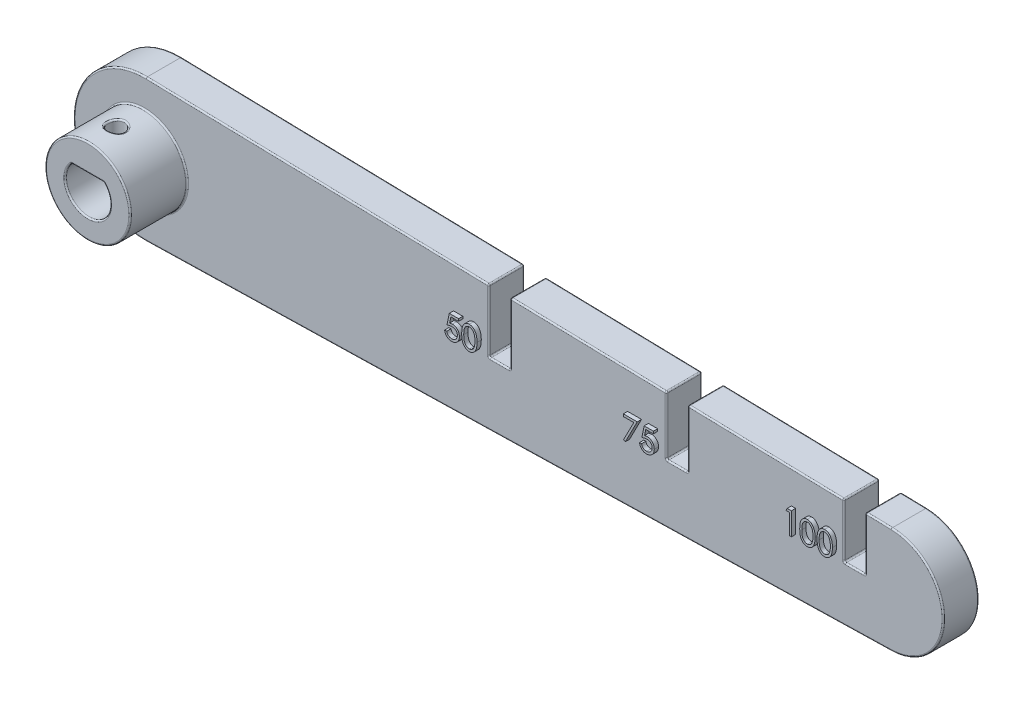
from build123d import *

# Parameters (mm, degrees)
BOSS_EXTRUDE1_DEPTH = 5
CUT_EXTRUDE2_REACH  = 115.054
CUT_EXTRUDE3_REACH  = 115.054
SKETCH4_W           = 3
SKETCH4_H           = 7.656932545
SKETCH4_H_2         = 8.25233943
SKETCH4_H_3         = 8.847746315
SKETCH6_R           = 6
BOSS_EXTRUDE3_DEPTH = 8
CUT_EXTRUDE4_REACH  = 115.689
SKETCH7_R           = 1.15
FILLET1_R           = 0.2
BOSS_EXTRUDE2_DEPTH = 0.6


with BuildPart() as part:
    # Sketch3 → Boss-Extrude1 (new body)
    with BuildSketch(Plane.XY):
        with BuildLine():
            Line((0.238095238, 9.997165131), (105.178571429, 7.497873848))
            ThreePointArc((105.178571429, 7.497873848), (112.5, 0), (105.178571429, -7.497873848))
            Line((105.178571429, -7.497873848), (0.238095238, -9.997165131))
            ThreePointArc((0.238095238, -9.997165131), (-10, 0), (0.238095238, 9.997165131))
        make_face()
    extrude(amount=BOSS_EXTRUDE1_DEPTH)

    # Sketch2 → Cut-Extrude2 (cut, up to next)
    with BuildSketch(Plane.XY, mode=Mode.PRIVATE) as cut_extrude2_sk1:
        with BuildLine():
            Line((-2.264950331, 2.225), (2.264950331, 2.225))
            ThreePointArc((2.264950331, 2.225), (0, -3.175), (-2.264950331, 2.225))
        make_face()
    cut_extrude2_tool1 = extrude(cut_extrude2_sk1.sketch, amount=CUT_EXTRUDE2_REACH, mode=Mode.PRIVATE) & part.part
    add(cut_extrude2_tool1.solids().sort_by_distance((0, -0.269884, 0))[0], mode=Mode.SUBTRACT)

    # Sketch4 → Cut-Extrude3 (cut, up to next)
    with BuildSketch(Plane.XY.offset(5), mode=Mode.PRIVATE) as cut_extrude3_sk1:
        with Locations((100, 3.828466273)):
            Rectangle(SKETCH4_W, SKETCH4_H)
    cut_extrude3_tool1 = extrude(cut_extrude3_sk1.sketch, amount=-CUT_EXTRUDE3_REACH, mode=Mode.PRIVATE) & part.part
    # Sketch4 → Cut-Extrude3 (cut, up to next)
    with BuildSketch(Plane.XY.offset(5), mode=Mode.PRIVATE) as cut_extrude3_sk2:
        with Locations((75, 4.126169715)):
            Rectangle(SKETCH4_W, SKETCH4_H_2)
    cut_extrude3_tool2 = extrude(cut_extrude3_sk2.sketch, amount=-CUT_EXTRUDE3_REACH, mode=Mode.PRIVATE) & part.part
    # Sketch4 → Cut-Extrude3 (cut, up to next)
    with BuildSketch(Plane.XY.offset(5), mode=Mode.PRIVATE) as cut_extrude3_sk3:
        with Locations((50, 4.423873158)):
            Rectangle(SKETCH4_W, SKETCH4_H_3)
    cut_extrude3_tool3 = extrude(cut_extrude3_sk3.sketch, amount=-CUT_EXTRUDE3_REACH, mode=Mode.PRIVATE) & part.part
    add(cut_extrude3_tool1.solids().sort_by_distance((100, 3.828466, 5))[0], mode=Mode.SUBTRACT)
    add(cut_extrude3_tool2.solids().sort_by_distance((75, 4.12617, 5))[0], mode=Mode.SUBTRACT)
    add(cut_extrude3_tool3.solids().sort_by_distance((50, 4.423873, 5))[0], mode=Mode.SUBTRACT)

    # Sketch6 → Boss-Extrude3 (add)
    with BuildSketch(Plane.XY.offset(5)):
        Circle(SKETCH6_R)
        with BuildLine():
            Line((-2.264950331, 2.225), (2.264950331, 2.225))
            ThreePointArc((2.264950331, 2.225), (0, -3.175), (-2.264950331, 2.225))
        make_face(mode=Mode.SUBTRACT)
    extrude(amount=BOSS_EXTRUDE3_DEPTH)

    # Sketch7 → Cut-Extrude4 (cut, up to next)
    with BuildSketch(Plane(origin=(0, 0, 0), x_dir=(1, 0, 0), z_dir=(0, 1, 0)), mode=Mode.PRIVATE) as cut_extrude4_sk1:
        with Locations((0, -9)):
            Circle(SKETCH7_R)
    cut_extrude4_tool1 = extrude(cut_extrude4_sk1.sketch, amount=CUT_EXTRUDE4_REACH, mode=Mode.PRIVATE) & part.part
    add(cut_extrude4_tool1.solids().sort_by_distance((0, 0, 9))[0], mode=Mode.SUBTRACT)

    # Fillet1
    fillet1_edges = [part.edges().sort_by_distance(p)[0] for p in [
        (51.5, 0, 2.5),
        (48.5, 0, 2.5),
        (101.5, 0, 2.5),
        (98.5, 0, 2.5),
        (76.5, 0, 2.5),
        (73.5, 0, 2.5),
        (0, 2.225, 0),
        (0, -3.175, 0),
        (76.5, 4.090445302, 0),
        (75, 0, 0),
        (73.5, 4.126169715, 0),
        (62.5, 8.51431846, 0),
        (51.5, 4.388148745, 0),
        (50, 0, 0),
        (48.5, 4.423873158, 0),
        (24.369047619, 9.422455723, 0),
        (-10, 0, 0),
        (52.708333333, -8.74751949, 0),
        (112.5, 0, 0),
        (103.339285714, 7.541678783, 0),
        (101.5, 3.792741859, 0),
        (100, 0, 0),
        (98.5, 3.828466272, 0),
        (87.5, 7.918911574, 0),
        (100, 0, 5),
        (101.5, 3.792741859, 5),
        (103.339285714, 7.541678783, 5),
        (112.5, 0, 5),
        (52.708333333, -8.74751949, 5),
        (-10, 0, 5),
        (24.369047619, 9.422455723, 5),
        (48.5, 4.423873158, 5),
        (50, 0, 5),
        (51.5, 4.388148745, 5),
        (62.5, 8.51431846, 5),
        (73.5, 4.126169715, 5),
        (75, 0, 5),
        (76.5, 4.090445302, 5),
        (87.5, 7.918911574, 5),
        (98.5, 3.828466272, 5),
        (101.5, 7.585483719, 2.5),
        (98.5, 7.656932545, 2.5),
        (76.5, 8.180890604, 2.5),
        (73.5, 8.25233943, 2.5),
        (51.5, 8.776297489, 2.5),
        (48.5, 8.847746315, 2.5),
        (-6, 0, 5),
        (0, 2.225, 13),
        (2.264950331, 2.225, 6.5),
        (0, -3.175, 13),
        (-2.264950331, 2.225, 6.5),
        (-1.150000012, 5.888760487, 9.000000001),
        (-1.15, 2.225, 9),
        (-6, 0, 13),
    ]]
    fillet(fillet1_edges, radius=FILLET1_R)

    # Sketch5 → Boss-Extrude2 (add)
    # profile 1 of 7: a face of its own
    with BuildSketch(Plane.XY.offset(5)):
        with BuildLine():
            Line((44.816666667, 3.175), (44.816666667, 2.849358974))
            Line((44.816666667, 2.849358974), (43.736708734, 2.849358974))
            Line((43.736708734, 2.849358974), (43.565619992, 2.014267829))
            add(Edge.make_bspline(
                [(43.565619992, 2.014267829), (43.599234964, 2.023548147), (43.664358655, 2.041527295), (43.760479386, 2.061489672), (43.851730885, 2.073523325), (43.910944971, 2.075166443), (43.939598357, 2.075961538)],
                knots=[0, 0, 0, 0, 1.100273476, 2.13160584, 3.095893838, 4, 4, 4, 4], degree=3))
            add(Edge.make_bspline(
                [(43.939598357, 2.075961538), (43.975052893, 2.075194154), (44.044765367, 2.073685284), (44.146763555, 2.059196535), (44.244129822, 2.036391041), (44.336660544, 2.004531711), (44.424526901, 1.963792167), (44.506920474, 1.912901507), (44.58507801, 1.853453414), (44.657597363, 1.785104724), (44.723387271, 1.709882972), (44.781232133, 1.629004046), (44.83036534, 1.543253952), (44.869881167, 1.4518134), (44.901435528, 1.355693311), (44.922437695, 1.253882325), (44.936422852, 1.147340102), (44.937985302, 1.074492385), (44.938782051, 1.037344752)],
                knots=[0, 0, 0, 0, 1.052922333, 2.070308379, 3.05430497, 4.020497103, 4.973039431, 5.925935799, 6.892292201, 7.88610001, 8.88166317, 9.857072816, 10.836096531, 11.812156883, 12.81219415, 13.836441305, 14.89672472, 16, 16, 16, 16], degree=3))
            add(Edge.make_bspline(
                [(44.938782051, 1.037344752), (44.938178733, 1.011471023), (44.93698025, 0.960073227), (44.930885531, 0.883742417), (44.919150989, 0.809027561), (44.903395982, 0.735918748), (44.882946788, 0.664554389), (44.858191718, 0.594730218), (44.82789675, 0.526880824), (44.79466686, 0.460364216), (44.757250412, 0.396684142), (44.715722766, 0.337131132), (44.671848356, 0.28081182), (44.624639385, 0.228330219), (44.573657054, 0.180031196), (44.519518798, 0.135628112), (44.462656617, 0.094370048), (44.40219079, 0.057931757), (44.339468681, 0.024401075), (44.273584512, -0.003106705), (44.20603802, -0.027699827), (44.135857025, -0.047302756), (44.063200495, -0.062663002), (43.987948663, -0.073095689), (43.910496198, -0.080694315), (43.857995294, -0.081169982), (43.831475361, -0.081410256)],
                knots=[0, 0, 0, 0, 1.056347294, 2.098418968, 3.122841568, 4.141288669, 5.149314143, 6.15115421, 7.162517403, 8.180376062, 9.185164535, 10.17417709, 11.141909838, 12.097768115, 13.052685741, 14.0056014, 14.954263652, 15.917497458, 16.885230207, 17.854509472, 18.828990115, 19.81800267, 20.826176721, 21.857883937, 22.917946725, 24, 24, 24, 24], degree=3))
            add(Edge.make_bspline(
                [(43.831475361, -0.081410256), (43.799839497, -0.080783568), (43.737599672, -0.079550632), (43.646413157, -0.066652434), (43.558679194, -0.048179453), (43.47510403, -0.02038798), (43.39493867, 0.014434781), (43.319262347, 0.058445879), (43.246141393, 0.10831978), (43.178548331, 0.167175529), (43.115813857, 0.231506183), (43.05965581, 0.301317758), (43.009641779, 0.375458038), (42.96657268, 0.454287077), (42.929835189, 0.537597745), (42.90097445, 0.625702181), (42.877680514, 0.718140042), (42.867825839, 0.781779298), (42.862820513, 0.814102564)],
                knots=[0, 0, 0, 0, 1.0467383, 2.05933395, 3.04377827, 4.011590433, 4.970194871, 5.932262533, 6.905835911, 7.896367577, 8.894135286, 9.877477877, 10.858688626, 11.851381753, 12.8477658, 13.868841284, 14.917554742, 16, 16, 16, 16], degree=3))
            Line((42.862820513, 0.814102564), (43.14775641, 0.814102564))
            add(Edge.make_bspline(
                [(43.14775641, 0.814102564), (43.154767316, 0.783825354), (43.168242666, 0.725630874), (43.197820738, 0.643868872), (43.233984782, 0.571007861), (43.276987298, 0.506084025), (43.328286254, 0.449470149), (43.386823665, 0.399017529), (43.452453385, 0.353501518), (43.525381529, 0.315562294), (43.602319108, 0.283205639), (43.682843649, 0.261659459), (43.764762592, 0.246509363), (43.820169399, 0.244992837), (43.848011819, 0.244230769)],
                knots=[0, 0, 0, 0, 1.136247022, 2.183929868, 3.172523383, 4.106158343, 5.02341133, 5.958108904, 6.928429099, 7.938127109, 8.96079061, 9.975095812, 10.982467395, 12, 12, 12, 12], degree=3))
            add(Edge.make_bspline(
                [(43.848011819, 0.244230769), (43.875188408, 0.244975332), (43.928699334, 0.246441382), (44.007449663, 0.257725343), (44.083479913, 0.275103997), (44.156039872, 0.301111651), (44.226399269, 0.332720789), (44.292778332, 0.37328375), (44.357097371, 0.419965339), (44.417357178, 0.473447424), (44.472547249, 0.532384219), (44.521311731, 0.59541014), (44.561930788, 0.662644708), (44.596161015, 0.732923925), (44.622153651, 0.807018045), (44.640696541, 0.884579825), (44.65158503, 0.965800843), (44.653082886, 1.021199431), (44.653846154, 1.049429087)],
                knots=[0, 0, 0, 0, 1.027316725, 2.022795036, 3.002884548, 3.971462791, 4.93288096, 5.914575861, 6.907176829, 7.935150275, 8.956128384, 9.956726525, 10.942570165, 11.921478529, 12.907843606, 13.90538589, 14.932640048, 16, 16, 16, 16], degree=3))
            add(Edge.make_bspline(
                [(44.653846154, 1.049429087), (44.653248819, 1.074897804), (44.652079621, 1.124749195), (44.642526889, 1.197682761), (44.625910778, 1.266691878), (44.602847687, 1.33210979), (44.573565563, 1.393998198), (44.537782122, 1.452420974), (44.494825825, 1.506608094), (44.445756755, 1.556584911), (44.392001246, 1.602708476), (44.332634423, 1.642027754), (44.268898632, 1.675105737), (44.201561781, 1.703651707), (44.129022195, 1.724153812), (44.052716392, 1.739546108), (43.971820379, 1.748450044), (43.916511254, 1.749685471), (43.888080929, 1.750320513)],
                knots=[0, 0, 0, 0, 1.045622112, 2.046656509, 3.013763289, 3.955457236, 4.890082067, 5.820317437, 6.762574623, 7.722996705, 8.69280354, 9.665887285, 10.63943826, 11.638615906, 12.663482002, 13.728887084, 14.832589034, 16, 16, 16, 16], degree=3))
            add(Edge.make_bspline(
                [(43.888080929, 1.750320513), (43.863471115, 1.749793834), (43.812658093, 1.748706375), (43.734713815, 1.740699481), (43.652806323, 1.727782407), (43.567249602, 1.710014883), (43.477786713, 1.686763834), (43.384606449, 1.658901395), (43.287512893, 1.625589296), (43.222091814, 1.600432216), (43.188461538, 1.5875)],
                knots=[0, 0, 0, 0, 0.817624296, 1.688186739, 2.600797293, 3.572016777, 4.590301741, 5.671205678, 6.80286297, 8, 8, 8, 8], degree=3))
            Line((43.188461538, 1.5875), (43.514102564, 3.175))
            Line((43.514102564, 3.175), (44.816666667, 3.175))
        make_face()
    # profile 2 of 7: a face of its own
    with BuildSketch(Plane.XY.offset(5)):
        with BuildLine():
            add(Edge.make_bspline(
                [(45.264423077, 1.586227965), (45.264720636, 1.637116309), (45.26529865, 1.735967652), (45.27172886, 1.880008006), (45.282410778, 2.015136268), (45.29704968, 2.141358907), (45.314864134, 2.258708507), (45.338645325, 2.366871466), (45.365689796, 2.466348394), (45.3970338, 2.557463681), (45.432401295, 2.641444883), (45.470895231, 2.719844887), (45.514043295, 2.792545069), (45.559379494, 2.860705779), (45.608739016, 2.923211273), (45.660717205, 2.98094426), (45.717342764, 3.032570441), (45.776690779, 3.079602444), (45.839298571, 3.120831607), (45.903381561, 3.15714702), (45.969380836, 3.188171185), (46.037476588, 3.212564652), (46.107056765, 3.232713063), (46.178364604, 3.246491609), (46.251517842, 3.25516109), (46.300894929, 3.255989917), (46.325936498, 3.256410256)],
                knots=[0, 0, 0, 0, 1.646270934, 3.197905019, 4.663502075, 6.030701355, 7.308322542, 8.50163776, 9.611534131, 10.641858119, 11.616356847, 12.558055219, 13.465016945, 14.349605745, 15.204443733, 16.039544428, 16.859896111, 17.680448484, 18.487036065, 19.28249412, 20.06191084, 20.843045899, 21.620316918, 22.403196591, 23.190181807, 24, 24, 24, 24], degree=3))
            add(Edge.make_bspline(
                [(46.325936498, 3.256410256), (46.351187254, 3.255967738), (46.401403062, 3.255087709), (46.475643974, 3.246629561), (46.548169756, 3.232595043), (46.618671211, 3.212709587), (46.687727449, 3.188039223), (46.754798333, 3.157117338), (46.820300471, 3.121122937), (46.883192946, 3.07882842), (46.944166204, 3.031673069), (47.001722571, 2.978366934), (47.055867284, 2.91944826), (47.107279883, 2.855547427), (47.154501746, 2.785438814), (47.199471931, 2.7103418), (47.239723706, 2.628943087), (47.278490162, 2.542600805), (47.311951928, 2.448925915), (47.342129165, 2.348446454), (47.366512229, 2.239975584), (47.386822498, 2.124082419), (47.402556796, 2.000341345), (47.414016407, 1.869017616), (47.420069849, 1.730024833), (47.421209856, 1.634994498), (47.421794872, 1.586227965)],
                knots=[0, 0, 0, 0, 0.810914788, 1.612654377, 2.396697861, 3.181598691, 3.963628158, 4.749916497, 5.551656086, 6.361998678, 7.18212741, 8.025565596, 8.878627764, 9.750805457, 10.657531673, 11.591944965, 12.560506719, 13.57287815, 14.630710178, 15.753379473, 16.941251878, 18.199788006, 19.531962791, 20.947069417, 22.433333509, 24, 24, 24, 24], degree=3))
            add(Edge.make_bspline(
                [(47.421794872, 1.586227965), (47.421203792, 1.537674134), (47.420052096, 1.443068975), (47.414084269, 1.30470159), (47.402328939, 1.174074794), (47.387624164, 1.050875303), (47.367257933, 0.935615891), (47.342216104, 0.827897713), (47.314411883, 0.727255591), (47.280090319, 0.634514012), (47.242524889, 0.548379235), (47.20165339, 0.467945464), (47.157865762, 0.392501756), (47.110160258, 0.322651986), (47.059311804, 0.257901347), (47.004232096, 0.199392789), (46.946473779, 0.145716537), (46.885321088, 0.097953989), (46.821447752, 0.056148487), (46.756170589, 0.018761637), (46.688331377, -0.011385165), (46.619467484, -0.037270523), (46.548593895, -0.057046647), (46.475798955, -0.070720788), (46.401452941, -0.080310965), (46.351195807, -0.081042557), (46.325936498, -0.081410256)],
                knots=[0, 0, 0, 0, 1.561518951, 3.042555995, 4.452378317, 5.7783523, 7.031515105, 8.214008947, 9.334062868, 10.386615937, 11.391082383, 12.354592575, 13.286541444, 14.194233754, 15.072674879, 15.931287219, 16.775624067, 17.606195743, 18.42308326, 19.229000347, 20.022332153, 20.807536673, 21.593273796, 22.3848459, 23.188221202, 24, 24, 24, 24], degree=3))
            add(Edge.make_bspline(
                [(46.325936498, -0.081410256), (46.300895624, -0.080987205), (46.251519906, -0.080153031), (46.178356634, -0.071522718), (46.107343275, -0.057647511), (46.038129405, -0.038219592), (45.970359924, -0.01443899), (45.904958292, 0.01654328), (45.841197322, 0.052224899), (45.779247125, 0.092860746), (45.720271807, 0.139416844), (45.663939501, 0.190910163), (45.611665377, 0.248625686), (45.56301159, 0.311652088), (45.51677081, 0.379409529), (45.47423545, 0.452823125), (45.434891889, 0.531601779), (45.39892958, 0.616254455), (45.367044721, 0.708016425), (45.338880014, 0.807937466), (45.316642171, 0.916899507), (45.297607633, 1.034027404), (45.2822548, 1.15982447), (45.271773376, 1.294358997), (45.265295184, 1.437547151), (45.264719084, 1.535763303), (45.264423077, 1.586227965)],
                knots=[0, 0, 0, 0, 0.810891512, 1.598919785, 2.382837074, 3.152667961, 3.926044502, 4.706494248, 5.493654104, 6.291793342, 7.103789334, 7.925228297, 8.761435821, 9.622817696, 10.50288917, 11.416980706, 12.369136599, 13.353924996, 14.394355917, 15.514179734, 16.714354668, 17.994756427, 19.357759367, 20.818452758, 22.365282078, 24, 24, 24, 24], degree=3))
        make_face()
        with BuildLine():
            add(Edge.make_bspline(
                [(45.549358974, 1.5875), (45.54946733, 1.545092252), (45.549677627, 1.46278714), (45.555171466, 1.343186467), (45.562655605, 1.231634812), (45.572308782, 1.127990532), (45.586644313, 1.03260445), (45.6027069, 0.944820523), (45.622254095, 0.865103315), (45.645381719, 0.792905801), (45.671724328, 0.727002717), (45.700486076, 0.665678758), (45.731384017, 0.608209501), (45.765963532, 0.555111156), (45.803623625, 0.506210565), (45.843513653, 0.46064221), (45.887122355, 0.420004948), (45.94745075, 0.371267015), (46.027094694, 0.32090323), (46.12744325, 0.27704642), (46.230556774, 0.249485191), (46.300543979, 0.245980213), (46.335476763, 0.244230769)],
                knots=[0, 0, 0, 0, 1.459021318, 2.831673884, 4.118529203, 5.306027144, 6.411944654, 7.436330062, 8.375795394, 9.233974572, 10.042671642, 10.816086306, 11.563610507, 12.285937304, 12.993564865, 13.685989202, 14.367179055, 15.041617293, 16.353048772, 17.594441528, 18.799311195, 20, 20, 20, 20], degree=3))
            add(Edge.make_bspline(
                [(46.335476763, 0.244230769), (46.370635508, 0.245680185), (46.440880408, 0.248576023), (46.543508922, 0.276514878), (46.643140667, 0.318669388), (46.721220213, 0.368514626), (46.780622235, 0.415983896), (46.823182647, 0.456455755), (46.862246077, 0.501772864), (46.899295673, 0.550667225), (46.933276406, 0.604072978), (46.964176538, 0.661733315), (46.992373575, 0.723808354), (47.00843821, 0.767142332), (47.016651643, 0.789297877)],
                knots=[0, 0, 0, 0, 1.353760809, 2.704726607, 4.075137775, 5.516104923, 6.260822281, 7.007110065, 7.778089737, 8.566572457, 9.372053459, 10.217411131, 11.088608312, 12, 12, 12, 12], degree=3))
            add(Edge.make_bspline(
                [(47.016651643, 0.789297877), (47.026223603, 0.817627712), (47.045658789, 0.875149426), (47.070706613, 0.964379311), (47.090432796, 1.057998961), (47.108179564, 1.155448888), (47.120292693, 1.25744776), (47.130042495, 1.36367998), (47.135785332, 1.474225644), (47.136497214, 1.549332529), (47.136858974, 1.5875)],
                knots=[0, 0, 0, 0, 0.884706709, 1.796334032, 2.740027952, 3.714592787, 4.726048262, 5.777819803, 6.87074269, 8, 8, 8, 8], degree=3))
            add(Edge.make_bspline(
                [(47.136858974, 1.5875), (47.136359874, 1.625661298), (47.135383527, 1.700312955), (47.131651553, 1.809640161), (47.122014453, 1.913478773), (47.111310967, 2.01227613), (47.095529202, 2.105485333), (47.078513191, 2.193886682), (47.055652092, 2.276384997), (47.03123201, 2.354271903), (47.00328258, 2.426662497), (46.972516164, 2.493894289), (46.939657854, 2.556291861), (46.903968822, 2.613684015), (46.865872738, 2.666327822), (46.824364104, 2.713167775), (46.781089423, 2.755655596), (46.72047669, 2.804153784), (46.641125013, 2.853603679), (46.542386461, 2.89911119), (46.439633805, 2.925244427), (46.370170743, 2.928928957), (46.335476763, 2.930769231)],
                knots=[0, 0, 0, 0, 1.31362396, 2.569729283, 3.763502607, 4.902122613, 5.988968491, 7.01645872, 7.998833611, 8.933434873, 9.825090667, 10.667526885, 11.477055099, 12.250526234, 12.991942729, 13.710640831, 14.402115721, 15.076753259, 16.378508321, 17.609869233, 18.806226677, 20, 20, 20, 20], degree=3))
            add(Edge.make_bspline(
                [(46.335476763, 2.930769231), (46.300360726, 2.928926418), (46.230064678, 2.925237437), (46.126244034, 2.899208557), (46.026726515, 2.853839652), (45.947584674, 2.80399), (45.886929667, 2.756511674), (45.844218938, 2.715339677), (45.804172053, 2.670303432), (45.76728064, 2.620953123), (45.732728219, 2.567916683), (45.700995443, 2.510776875), (45.672404722, 2.449244137), (45.646020893, 2.383370657), (45.622822721, 2.311179371), (45.603687483, 2.231560356), (45.586009942, 2.144055639), (45.573495662, 2.048152943), (45.562370684, 1.944482704), (45.555221175, 1.832652565), (45.549659249, 1.712851306), (45.549461071, 1.630120641), (45.549358974, 1.5875)],
                knots=[0, 0, 0, 0, 1.207732386, 2.417664972, 3.655092373, 4.956220595, 5.625982001, 6.301752483, 6.994047911, 7.697131622, 8.419323945, 9.170223765, 9.943494443, 10.752040957, 11.610060368, 12.549350801, 13.567764191, 14.679664412, 15.874934091, 17.154273443, 18.533957287, 20, 20, 20, 20], degree=3))
        make_face(mode=Mode.SUBTRACT)
    # profile 3 of 7: a face of its own
    with BuildSketch(Plane.XY.offset(5)):
        Polygon((68.025641026, 3.175), (69.979487179, 3.175), (68.310576923, -0.081410256), (68.064438101, 0.054061498), (69.497385817, 2.849358974), (68.025641026, 2.849358974), align=None)
    # profile 4 of 7: a face of its own
    with BuildSketch(Plane.XY.offset(5)):
        with BuildLine():
            Line((72.258974359, 3.175), (72.258974359, 2.849358974))
            Line((72.258974359, 2.849358974), (71.179016426, 2.849358974))
            Line((71.179016426, 2.849358974), (71.007927684, 2.014267829))
            add(Edge.make_bspline(
                [(71.007927684, 2.014267829), (71.041542656, 2.023548147), (71.106666347, 2.041527295), (71.202787078, 2.061489672), (71.294038577, 2.073523325), (71.353252663, 2.075166443), (71.38190605, 2.075961538)],
                knots=[0, 0, 0, 0, 1.100273476, 2.13160584, 3.095893838, 4, 4, 4, 4], degree=3))
            add(Edge.make_bspline(
                [(71.38190605, 2.075961538), (71.417360585, 2.075194154), (71.48707306, 2.073685284), (71.589071247, 2.059196535), (71.686437515, 2.036391041), (71.778968236, 2.004531711), (71.866834593, 1.963792167), (71.949228167, 1.912901507), (72.027385702, 1.853453414), (72.099905055, 1.785104724), (72.165694963, 1.709882972), (72.223539825, 1.629004046), (72.272673032, 1.543253952), (72.31218886, 1.4518134), (72.34374322, 1.355693311), (72.364745387, 1.253882325), (72.378730544, 1.147340102), (72.380292995, 1.074492385), (72.381089744, 1.037344752)],
                knots=[0, 0, 0, 0, 1.052922333, 2.070308379, 3.05430497, 4.020497103, 4.973039431, 5.925935799, 6.892292201, 7.88610001, 8.88166317, 9.857072816, 10.836096531, 11.812156883, 12.81219415, 13.836441305, 14.89672472, 16, 16, 16, 16], degree=3))
            add(Edge.make_bspline(
                [(72.381089744, 1.037344752), (72.380486425, 1.011471023), (72.379287942, 0.960073227), (72.373193223, 0.883742417), (72.361458681, 0.809027561), (72.345703674, 0.735918748), (72.325254481, 0.664554389), (72.30049941, 0.594730218), (72.270204442, 0.526880824), (72.236974552, 0.460364216), (72.199558104, 0.396684142), (72.158030458, 0.337131132), (72.114156048, 0.28081182), (72.066947077, 0.228330219), (72.015964746, 0.180031196), (71.96182649, 0.135628112), (71.904964309, 0.094370048), (71.844498482, 0.057931757), (71.781776373, 0.024401075), (71.715892204, -0.003106705), (71.648345712, -0.027699827), (71.578164718, -0.047302756), (71.505508188, -0.062663002), (71.430256356, -0.073095689), (71.352803891, -0.080694315), (71.300302986, -0.081169982), (71.273783053, -0.081410256)],
                knots=[0, 0, 0, 0, 1.056347294, 2.098418968, 3.122841568, 4.141288669, 5.149314143, 6.15115421, 7.162517403, 8.180376062, 9.185164535, 10.17417709, 11.141909838, 12.097768115, 13.052685741, 14.0056014, 14.954263652, 15.917497458, 16.885230207, 17.854509472, 18.828990115, 19.81800267, 20.826176721, 21.857883937, 22.917946725, 24, 24, 24, 24], degree=3))
            add(Edge.make_bspline(
                [(71.273783053, -0.081410256), (71.242147189, -0.080783568), (71.179907364, -0.079550632), (71.08872085, -0.066652434), (71.000986886, -0.048179453), (70.917411723, -0.02038798), (70.837246362, 0.014434781), (70.761570039, 0.058445879), (70.688449085, 0.10831978), (70.620856024, 0.167175529), (70.558121549, 0.231506183), (70.501963502, 0.301317758), (70.451949471, 0.375458038), (70.408880372, 0.454287077), (70.372142882, 0.537597745), (70.343282142, 0.625702181), (70.319988206, 0.718140042), (70.310133532, 0.781779298), (70.305128205, 0.814102564)],
                knots=[0, 0, 0, 0, 1.0467383, 2.05933395, 3.04377827, 4.011590433, 4.970194871, 5.932262533, 6.905835911, 7.896367577, 8.894135286, 9.877477877, 10.858688626, 11.851381753, 12.8477658, 13.868841284, 14.917554742, 16, 16, 16, 16], degree=3))
            Line((70.305128205, 0.814102564), (70.590064103, 0.814102564))
            add(Edge.make_bspline(
                [(70.590064103, 0.814102564), (70.597075008, 0.783825354), (70.610550358, 0.725630874), (70.64012843, 0.643868872), (70.676292474, 0.571007861), (70.71929499, 0.506084025), (70.770593947, 0.449470149), (70.829131357, 0.399017529), (70.894761078, 0.353501518), (70.967689221, 0.315562294), (71.044626801, 0.283205639), (71.125151341, 0.261659459), (71.207070284, 0.246509363), (71.262477091, 0.244992837), (71.290319511, 0.244230769)],
                knots=[0, 0, 0, 0, 1.136247022, 2.183929868, 3.172523383, 4.106158343, 5.02341133, 5.958108904, 6.928429099, 7.938127109, 8.96079061, 9.975095812, 10.982467395, 12, 12, 12, 12], degree=3))
            add(Edge.make_bspline(
                [(71.290319511, 0.244230769), (71.3174961, 0.244975332), (71.371007026, 0.246441382), (71.449757355, 0.257725343), (71.525787605, 0.275103997), (71.598347565, 0.301111651), (71.668706961, 0.332720789), (71.735086025, 0.37328375), (71.799405063, 0.419965339), (71.85966487, 0.473447424), (71.914854942, 0.532384219), (71.963619423, 0.59541014), (72.00423848, 0.662644708), (72.038468708, 0.732923925), (72.064461343, 0.807018045), (72.083004233, 0.884579825), (72.093892722, 0.965800843), (72.095390578, 1.021199431), (72.096153846, 1.049429087)],
                knots=[0, 0, 0, 0, 1.027316725, 2.022795036, 3.002884548, 3.971462791, 4.93288096, 5.914575861, 6.907176829, 7.935150275, 8.956128384, 9.956726525, 10.942570165, 11.921478529, 12.907843606, 13.90538589, 14.932640048, 16, 16, 16, 16], degree=3))
            add(Edge.make_bspline(
                [(72.096153846, 1.049429087), (72.095556511, 1.074897804), (72.094387313, 1.124749195), (72.084834581, 1.197682761), (72.068218471, 1.266691878), (72.04515538, 1.33210979), (72.015873255, 1.393998198), (71.980089814, 1.452420974), (71.937133518, 1.506608094), (71.888064447, 1.556584911), (71.834308939, 1.602708476), (71.774942115, 1.642027754), (71.711206324, 1.675105737), (71.643869473, 1.703651707), (71.571329887, 1.724153812), (71.495024085, 1.739546108), (71.414128071, 1.748450044), (71.358818947, 1.749685471), (71.330388622, 1.750320513)],
                knots=[0, 0, 0, 0, 1.045622112, 2.046656509, 3.013763289, 3.955457236, 4.890082067, 5.820317437, 6.762574623, 7.722996705, 8.69280354, 9.665887285, 10.63943826, 11.638615906, 12.663482002, 13.728887084, 14.832589034, 16, 16, 16, 16], degree=3))
            add(Edge.make_bspline(
                [(71.330388622, 1.750320513), (71.305778808, 1.749793834), (71.254965785, 1.748706375), (71.177021507, 1.740699481), (71.095114015, 1.727782407), (71.009557294, 1.710014883), (70.920094405, 1.686763834), (70.826914141, 1.658901395), (70.729820585, 1.625589296), (70.664399507, 1.600432216), (70.630769231, 1.5875)],
                knots=[0, 0, 0, 0, 0.817624296, 1.688186739, 2.600797293, 3.572016777, 4.590301741, 5.671205678, 6.80286297, 8, 8, 8, 8], degree=3))
            Line((70.630769231, 1.5875), (70.956410256, 3.175))
            Line((70.956410256, 3.175), (72.258974359, 3.175))
        make_face()
    # profile 5 of 7: a face of its own
    with BuildSketch(Plane.XY.offset(5)):
        Polygon((91.096930088, 3.175), (91.683974359, 3.175), (91.683974359, 0), (91.399038462, 0), (91.399038462, 2.849358974), (90.910576923, 2.849358974), align=None)
    # profile 6 of 7: a face of its own
    with BuildSketch(Plane.XY.offset(5)):
        with BuildLine():
            add(Edge.make_bspline(
                [(92.864423077, 1.586227965), (92.864720636, 1.637116309), (92.86529865, 1.735967652), (92.87172886, 1.880008006), (92.882410778, 2.015136268), (92.89704968, 2.141358907), (92.914864134, 2.258708507), (92.938645325, 2.366871466), (92.965689796, 2.466348394), (92.9970338, 2.557463681), (93.032401295, 2.641444883), (93.070895231, 2.719844887), (93.114043295, 2.792545069), (93.159379494, 2.860705779), (93.208739016, 2.923211273), (93.260717205, 2.98094426), (93.317342764, 3.032570441), (93.376690779, 3.079602444), (93.439298571, 3.120831607), (93.503381561, 3.15714702), (93.569380836, 3.188171185), (93.637476588, 3.212564652), (93.707056765, 3.232713063), (93.778364604, 3.246491609), (93.851517842, 3.25516109), (93.900894929, 3.255989917), (93.925936498, 3.256410256)],
                knots=[0, 0, 0, 0, 1.646270934, 3.197905019, 4.663502075, 6.030701355, 7.308322542, 8.50163776, 9.611534131, 10.641858119, 11.616356847, 12.558055219, 13.465016945, 14.349605745, 15.204443733, 16.039544428, 16.859896111, 17.680448484, 18.487036065, 19.28249412, 20.06191084, 20.843045899, 21.620316918, 22.403196591, 23.190181807, 24, 24, 24, 24], degree=3))
            add(Edge.make_bspline(
                [(93.925936498, 3.256410256), (93.951187254, 3.255967738), (94.001403062, 3.255087709), (94.075643974, 3.246629561), (94.148169756, 3.232595043), (94.218671211, 3.212709587), (94.287727449, 3.188039223), (94.354798333, 3.157117338), (94.420300471, 3.121122937), (94.483192946, 3.07882842), (94.544166204, 3.031673069), (94.601722571, 2.978366934), (94.655867284, 2.91944826), (94.707279883, 2.855547427), (94.754501746, 2.785438814), (94.799471931, 2.7103418), (94.839723706, 2.628943087), (94.878490162, 2.542600805), (94.911951928, 2.448925915), (94.942129165, 2.348446454), (94.966512229, 2.239975584), (94.986822498, 2.124082419), (95.002556796, 2.000341345), (95.014016407, 1.869017616), (95.020069849, 1.730024833), (95.021209856, 1.634994498), (95.021794872, 1.586227965)],
                knots=[0, 0, 0, 0, 0.810914788, 1.612654377, 2.396697861, 3.181598691, 3.963628158, 4.749916497, 5.551656086, 6.361998678, 7.18212741, 8.025565596, 8.878627764, 9.750805457, 10.657531673, 11.591944965, 12.560506719, 13.57287815, 14.630710178, 15.753379473, 16.941251878, 18.199788006, 19.531962791, 20.947069417, 22.433333509, 24, 24, 24, 24], degree=3))
            add(Edge.make_bspline(
                [(95.021794872, 1.586227965), (95.021203792, 1.537674134), (95.020052096, 1.443068975), (95.014084269, 1.30470159), (95.002328939, 1.174074794), (94.987624164, 1.050875303), (94.967257933, 0.935615891), (94.942216104, 0.827897713), (94.914411883, 0.727255591), (94.880090319, 0.634514012), (94.842524889, 0.548379235), (94.80165339, 0.467945464), (94.757865762, 0.392501756), (94.710160258, 0.322651986), (94.659311804, 0.257901347), (94.604232096, 0.199392789), (94.546473779, 0.145716537), (94.485321088, 0.097953989), (94.421447752, 0.056148487), (94.356170589, 0.018761637), (94.288331377, -0.011385165), (94.219467484, -0.037270523), (94.148593895, -0.057046647), (94.075798955, -0.070720788), (94.001452941, -0.080310965), (93.951195807, -0.081042557), (93.925936498, -0.081410256)],
                knots=[0, 0, 0, 0, 1.561518951, 3.042555995, 4.452378317, 5.7783523, 7.031515105, 8.214008947, 9.334062868, 10.386615937, 11.391082383, 12.354592575, 13.286541444, 14.194233754, 15.072674879, 15.931287219, 16.775624067, 17.606195743, 18.42308326, 19.229000347, 20.022332153, 20.807536673, 21.593273796, 22.3848459, 23.188221202, 24, 24, 24, 24], degree=3))
            add(Edge.make_bspline(
                [(93.925936498, -0.081410256), (93.900895624, -0.080987205), (93.851519906, -0.080153031), (93.778356634, -0.071522718), (93.707343275, -0.057647511), (93.638129405, -0.038219592), (93.570359924, -0.01443899), (93.504958292, 0.01654328), (93.441197322, 0.052224899), (93.379247125, 0.092860746), (93.320271807, 0.139416844), (93.263939501, 0.190910163), (93.211665377, 0.248625686), (93.16301159, 0.311652088), (93.11677081, 0.379409529), (93.07423545, 0.452823125), (93.034891889, 0.531601779), (92.99892958, 0.616254455), (92.967044721, 0.708016425), (92.938880014, 0.807937466), (92.916642171, 0.916899507), (92.897607633, 1.034027404), (92.8822548, 1.15982447), (92.871773376, 1.294358997), (92.865295184, 1.437547151), (92.864719084, 1.535763303), (92.864423077, 1.586227965)],
                knots=[0, 0, 0, 0, 0.810891512, 1.598919785, 2.382837074, 3.152667961, 3.926044502, 4.706494248, 5.493654104, 6.291793342, 7.103789334, 7.925228297, 8.761435821, 9.622817696, 10.50288917, 11.416980706, 12.369136599, 13.353924996, 14.394355917, 15.514179734, 16.714354668, 17.994756427, 19.357759367, 20.818452758, 22.365282078, 24, 24, 24, 24], degree=3))
        make_face()
        with BuildLine():
            add(Edge.make_bspline(
                [(93.149358974, 1.5875), (93.14946733, 1.545092252), (93.149677627, 1.46278714), (93.155171466, 1.343186467), (93.162655605, 1.231634812), (93.172308782, 1.127990532), (93.186644313, 1.03260445), (93.2027069, 0.944820523), (93.222254095, 0.865103315), (93.245381719, 0.792905801), (93.271724328, 0.727002717), (93.300486076, 0.665678758), (93.331384017, 0.608209501), (93.365963532, 0.555111156), (93.403623625, 0.506210565), (93.443513653, 0.46064221), (93.487122355, 0.420004948), (93.54745075, 0.371267015), (93.627094694, 0.32090323), (93.72744325, 0.27704642), (93.830556774, 0.249485191), (93.900543979, 0.245980213), (93.935476763, 0.244230769)],
                knots=[0, 0, 0, 0, 1.459021318, 2.831673884, 4.118529203, 5.306027144, 6.411944654, 7.436330062, 8.375795394, 9.233974572, 10.042671642, 10.816086306, 11.563610507, 12.285937304, 12.993564865, 13.685989202, 14.367179055, 15.041617293, 16.353048772, 17.594441528, 18.799311195, 20, 20, 20, 20], degree=3))
            add(Edge.make_bspline(
                [(93.935476763, 0.244230769), (93.970635508, 0.245680185), (94.040880408, 0.248576023), (94.143508922, 0.276514878), (94.243140667, 0.318669388), (94.321220213, 0.368514626), (94.380622235, 0.415983896), (94.423182647, 0.456455755), (94.462246077, 0.501772864), (94.499295673, 0.550667225), (94.533276406, 0.604072978), (94.564176538, 0.661733315), (94.592373575, 0.723808354), (94.60843821, 0.767142332), (94.616651643, 0.789297877)],
                knots=[0, 0, 0, 0, 1.353760809, 2.704726607, 4.075137775, 5.516104923, 6.260822281, 7.007110065, 7.778089737, 8.566572457, 9.372053459, 10.217411131, 11.088608312, 12, 12, 12, 12], degree=3))
            add(Edge.make_bspline(
                [(94.616651643, 0.789297877), (94.626223603, 0.817627712), (94.645658789, 0.875149426), (94.670706613, 0.964379311), (94.690432796, 1.057998961), (94.708179564, 1.155448888), (94.720292693, 1.25744776), (94.730042495, 1.36367998), (94.735785332, 1.474225644), (94.736497214, 1.549332529), (94.736858974, 1.5875)],
                knots=[0, 0, 0, 0, 0.884706709, 1.796334032, 2.740027952, 3.714592787, 4.726048262, 5.777819803, 6.87074269, 8, 8, 8, 8], degree=3))
            add(Edge.make_bspline(
                [(94.736858974, 1.5875), (94.736359874, 1.625661298), (94.735383527, 1.700312955), (94.731651553, 1.809640161), (94.722014453, 1.913478773), (94.711310967, 2.01227613), (94.695529202, 2.105485333), (94.678513191, 2.193886682), (94.655652092, 2.276384997), (94.63123201, 2.354271903), (94.60328258, 2.426662497), (94.572516164, 2.493894289), (94.539657854, 2.556291861), (94.503968822, 2.613684015), (94.465872738, 2.666327822), (94.424364104, 2.713167775), (94.381089423, 2.755655596), (94.32047669, 2.804153784), (94.241125013, 2.853603679), (94.142386461, 2.89911119), (94.039633805, 2.925244427), (93.970170743, 2.928928957), (93.935476763, 2.930769231)],
                knots=[0, 0, 0, 0, 1.31362396, 2.569729283, 3.763502607, 4.902122613, 5.988968491, 7.01645872, 7.998833611, 8.933434873, 9.825090667, 10.667526885, 11.477055099, 12.250526234, 12.991942729, 13.710640831, 14.402115721, 15.076753259, 16.378508321, 17.609869233, 18.806226677, 20, 20, 20, 20], degree=3))
            add(Edge.make_bspline(
                [(93.935476763, 2.930769231), (93.900360726, 2.928926418), (93.830064678, 2.925237437), (93.726244034, 2.899208557), (93.626726515, 2.853839652), (93.547584674, 2.80399), (93.486929667, 2.756511674), (93.444218938, 2.715339677), (93.404172053, 2.670303432), (93.36728064, 2.620953123), (93.332728219, 2.567916683), (93.300995443, 2.510776875), (93.272404722, 2.449244137), (93.246020893, 2.383370657), (93.222822721, 2.311179371), (93.203687483, 2.231560356), (93.186009942, 2.144055639), (93.173495662, 2.048152943), (93.162370684, 1.944482704), (93.155221175, 1.832652565), (93.149659249, 1.712851306), (93.149461071, 1.630120641), (93.149358974, 1.5875)],
                knots=[0, 0, 0, 0, 1.207732386, 2.417664972, 3.655092373, 4.956220595, 5.625982001, 6.301752483, 6.994047911, 7.697131622, 8.419323945, 9.170223765, 9.943494443, 10.752040957, 11.610060368, 12.549350801, 13.567764191, 14.679664412, 15.874934091, 17.154273443, 18.533957287, 20, 20, 20, 20], degree=3))
        make_face(mode=Mode.SUBTRACT)
    # profile 7 of 7: a face of its own
    with BuildSketch(Plane.XY.offset(5)):
        with BuildLine():
            add(Edge.make_bspline(
                [(95.306730769, 1.586227965), (95.307028329, 1.637116309), (95.307606342, 1.735967652), (95.314036552, 1.880008006), (95.32471847, 2.015136268), (95.339357372, 2.141358907), (95.357171826, 2.258708507), (95.380953017, 2.366871466), (95.407997488, 2.466348394), (95.439341493, 2.557463681), (95.474708987, 2.641444883), (95.513202924, 2.719844887), (95.556350987, 2.792545069), (95.601687187, 2.860705779), (95.651046709, 2.923211273), (95.703024897, 2.98094426), (95.759650456, 3.032570441), (95.818998471, 3.079602444), (95.881606264, 3.120831607), (95.945689254, 3.15714702), (96.011688528, 3.188171185), (96.07978428, 3.212564652), (96.149364458, 3.232713063), (96.220672297, 3.246491609), (96.293825534, 3.25516109), (96.343202621, 3.255989917), (96.368244191, 3.256410256)],
                knots=[0, 0, 0, 0, 1.646270934, 3.197905019, 4.663502075, 6.030701355, 7.308322542, 8.50163776, 9.611534131, 10.641858119, 11.616356847, 12.558055219, 13.465016945, 14.349605745, 15.204443733, 16.039544428, 16.859896111, 17.680448484, 18.487036065, 19.28249412, 20.06191084, 20.843045899, 21.620316918, 22.403196591, 23.190181807, 24, 24, 24, 24], degree=3))
            add(Edge.make_bspline(
                [(96.368244191, 3.256410256), (96.393494946, 3.255967738), (96.443710754, 3.255087709), (96.517951666, 3.246629561), (96.590477449, 3.232595043), (96.660978903, 3.212709587), (96.730035141, 3.188039223), (96.797106025, 3.157117338), (96.862608163, 3.121122937), (96.925500638, 3.07882842), (96.986473897, 3.031673069), (97.044030263, 2.978366934), (97.098174977, 2.91944826), (97.149587575, 2.855547427), (97.196809438, 2.785438814), (97.241779623, 2.7103418), (97.282031399, 2.628943087), (97.320797854, 2.542600805), (97.354259621, 2.448925915), (97.384436857, 2.348446454), (97.408819922, 2.239975584), (97.42913019, 2.124082419), (97.444864489, 2.000341345), (97.4563241, 1.869017616), (97.462377541, 1.730024833), (97.463517549, 1.634994498), (97.464102564, 1.586227965)],
                knots=[0, 0, 0, 0, 0.810914788, 1.612654377, 2.396697861, 3.181598691, 3.963628158, 4.749916497, 5.551656086, 6.361998678, 7.18212741, 8.025565596, 8.878627764, 9.750805457, 10.657531673, 11.591944965, 12.560506719, 13.57287815, 14.630710178, 15.753379473, 16.941251878, 18.199788006, 19.531962791, 20.947069417, 22.433333509, 24, 24, 24, 24], degree=3))
            add(Edge.make_bspline(
                [(97.464102564, 1.586227965), (97.463511484, 1.537674134), (97.462359788, 1.443068975), (97.456391961, 1.30470159), (97.444636631, 1.174074794), (97.429931856, 1.050875303), (97.409565626, 0.935615891), (97.384523796, 0.827897713), (97.356719575, 0.727255591), (97.322398012, 0.634514012), (97.284832582, 0.548379235), (97.243961082, 0.467945464), (97.200173454, 0.392501756), (97.15246795, 0.322651986), (97.101619496, 0.257901347), (97.046539788, 0.199392789), (96.988781472, 0.145716537), (96.92762878, 0.097953989), (96.863755444, 0.056148487), (96.798478282, 0.018761637), (96.73063907, -0.011385165), (96.661775177, -0.037270523), (96.590901587, -0.057046647), (96.518106647, -0.070720788), (96.443760633, -0.080310965), (96.393503499, -0.081042557), (96.368244191, -0.081410256)],
                knots=[0, 0, 0, 0, 1.561518951, 3.042555995, 4.452378317, 5.7783523, 7.031515105, 8.214008947, 9.334062868, 10.386615937, 11.391082383, 12.354592575, 13.286541444, 14.194233754, 15.072674879, 15.931287219, 16.775624067, 17.606195743, 18.42308326, 19.229000347, 20.022332153, 20.807536673, 21.593273796, 22.3848459, 23.188221202, 24, 24, 24, 24], degree=3))
            add(Edge.make_bspline(
                [(96.368244191, -0.081410256), (96.343203316, -0.080987205), (96.293827598, -0.080153031), (96.220664327, -0.071522718), (96.149650967, -0.057647511), (96.080437098, -0.038219592), (96.012667616, -0.01443899), (95.947265985, 0.01654328), (95.883505014, 0.052224899), (95.821554817, 0.092860746), (95.7625795, 0.139416844), (95.706247193, 0.190910163), (95.653973069, 0.248625686), (95.605319282, 0.311652088), (95.559078502, 0.379409529), (95.516543142, 0.452823125), (95.477199582, 0.531601779), (95.441237272, 0.616254455), (95.409352413, 0.708016425), (95.381187707, 0.807937466), (95.358949864, 0.916899507), (95.339915326, 1.034027404), (95.324562492, 1.15982447), (95.314081069, 1.294358997), (95.307602876, 1.437547151), (95.307026776, 1.535763303), (95.306730769, 1.586227965)],
                knots=[0, 0, 0, 0, 0.810891512, 1.598919785, 2.382837074, 3.152667961, 3.926044502, 4.706494248, 5.493654104, 6.291793342, 7.103789334, 7.925228297, 8.761435821, 9.622817696, 10.50288917, 11.416980706, 12.369136599, 13.353924996, 14.394355917, 15.514179734, 16.714354668, 17.994756427, 19.357759367, 20.818452758, 22.365282078, 24, 24, 24, 24], degree=3))
        make_face()
        with BuildLine():
            add(Edge.make_bspline(
                [(95.591666667, 1.5875), (95.591775022, 1.545092252), (95.591985319, 1.46278714), (95.597479158, 1.343186467), (95.604963297, 1.231634812), (95.614616474, 1.127990532), (95.628952006, 1.03260445), (95.645014592, 0.944820523), (95.664561787, 0.865103315), (95.687689411, 0.792905801), (95.71403202, 0.727002717), (95.742793768, 0.665678758), (95.773691709, 0.608209501), (95.808271225, 0.555111156), (95.845931318, 0.506210565), (95.885821346, 0.46064221), (95.929430047, 0.420004948), (95.989758442, 0.371267015), (96.069402387, 0.32090323), (96.169750942, 0.27704642), (96.272864466, 0.249485191), (96.342851671, 0.245980213), (96.377784455, 0.244230769)],
                knots=[0, 0, 0, 0, 1.459021318, 2.831673884, 4.118529203, 5.306027144, 6.411944654, 7.436330062, 8.375795394, 9.233974572, 10.042671642, 10.816086306, 11.563610507, 12.285937304, 12.993564865, 13.685989202, 14.367179055, 15.041617293, 16.353048772, 17.594441528, 18.799311195, 20, 20, 20, 20], degree=3))
            add(Edge.make_bspline(
                [(96.377784455, 0.244230769), (96.4129432, 0.245680185), (96.4831881, 0.248576023), (96.585816615, 0.276514878), (96.68544836, 0.318669388), (96.763527905, 0.368514626), (96.822929927, 0.415983896), (96.86549034, 0.456455755), (96.904553769, 0.501772864), (96.941603366, 0.550667225), (96.975584099, 0.604072978), (97.006484231, 0.661733315), (97.034681267, 0.723808354), (97.050745902, 0.767142332), (97.058959335, 0.789297877)],
                knots=[0, 0, 0, 0, 1.353760809, 2.704726607, 4.075137775, 5.516104923, 6.260822281, 7.007110065, 7.778089737, 8.566572457, 9.372053459, 10.217411131, 11.088608312, 12, 12, 12, 12], degree=3))
            add(Edge.make_bspline(
                [(97.058959335, 0.789297877), (97.068531296, 0.817627712), (97.087966481, 0.875149426), (97.113014305, 0.964379311), (97.132740488, 1.057998961), (97.150487256, 1.155448888), (97.162600385, 1.25744776), (97.172350187, 1.36367998), (97.178093025, 1.474225644), (97.178804906, 1.549332529), (97.179166667, 1.5875)],
                knots=[0, 0, 0, 0, 0.884706709, 1.796334032, 2.740027952, 3.714592787, 4.726048262, 5.777819803, 6.87074269, 8, 8, 8, 8], degree=3))
            add(Edge.make_bspline(
                [(97.179166667, 1.5875), (97.178667566, 1.625661298), (97.17769122, 1.700312955), (97.173959245, 1.809640161), (97.164322145, 1.913478773), (97.153618659, 2.01227613), (97.137836894, 2.105485333), (97.120820884, 2.193886682), (97.097959784, 2.276384997), (97.073539702, 2.354271903), (97.045590272, 2.426662497), (97.014823856, 2.493894289), (96.981965546, 2.556291861), (96.946276514, 2.613684015), (96.90818043, 2.666327822), (96.866671796, 2.713167775), (96.823397115, 2.755655596), (96.762784382, 2.804153784), (96.683432705, 2.853603679), (96.584694153, 2.89911119), (96.481941498, 2.925244427), (96.412478436, 2.928928957), (96.377784455, 2.930769231)],
                knots=[0, 0, 0, 0, 1.31362396, 2.569729283, 3.763502607, 4.902122613, 5.988968491, 7.01645872, 7.998833611, 8.933434873, 9.825090667, 10.667526885, 11.477055099, 12.250526234, 12.991942729, 13.710640831, 14.402115721, 15.076753259, 16.378508321, 17.609869233, 18.806226677, 20, 20, 20, 20], degree=3))
            add(Edge.make_bspline(
                [(96.377784455, 2.930769231), (96.342668418, 2.928926418), (96.272372371, 2.925237437), (96.168551726, 2.899208557), (96.069034207, 2.853839652), (95.989892366, 2.80399), (95.92923736, 2.756511674), (95.886526631, 2.715339677), (95.846479746, 2.670303432), (95.809588332, 2.620953123), (95.775035911, 2.567916683), (95.743303135, 2.510776875), (95.714712415, 2.449244137), (95.688328585, 2.383370657), (95.665130413, 2.311179371), (95.645995175, 2.231560356), (95.628317634, 2.144055639), (95.615803355, 2.048152943), (95.604678376, 1.944482704), (95.597528868, 1.832652565), (95.591966941, 1.712851306), (95.591768763, 1.630120641), (95.591666667, 1.5875)],
                knots=[0, 0, 0, 0, 1.207732386, 2.417664972, 3.655092373, 4.956220595, 5.625982001, 6.301752483, 6.994047911, 7.697131622, 8.419323945, 9.170223765, 9.943494443, 10.752040957, 11.610060368, 12.549350801, 13.567764191, 14.679664412, 15.874934091, 17.154273443, 18.533957287, 20, 20, 20, 20], degree=3))
        make_face(mode=Mode.SUBTRACT)
    extrude(amount=BOSS_EXTRUDE2_DEPTH)


solid = part.part
